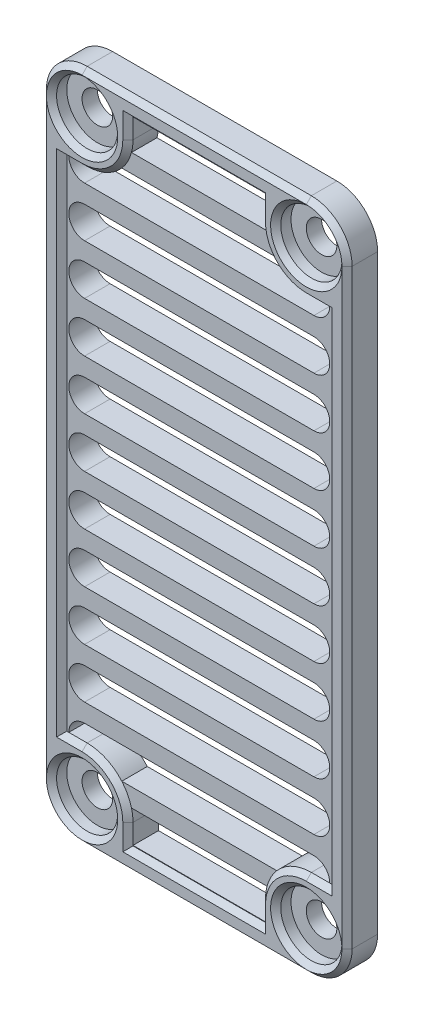
from build123d import *

# Parameters (mm, degrees)
BASE_DEPTH          = 3
SKETCH2_R           = 1.5
CUT_EXTRUDE1_DEPTH  = 37.373066959
CUT_EXTRUDE2_DEPTH  = 37.373066959
SKETCH6_R           = 3
CUT_EXTRUDE3_DEPTH  = 1.5
CHAMFER2_SIZE       = 0.5
BOSS_EXTRUDE1_START = -2.5
BOSS_EXTRUDE1_DEPTH = 2.5
CUT_EXTRUDE4_START  = -2.5
CUT_EXTRUDE4_DEPTH  = 2.5


# Read off the part's stored shape, not the designer's step: Cut-Extrude4
with BuildPart() as part:
    # Sketch1 → Base (new body)
    with BuildSketch(Plane.XY):
        with BuildLine():
            Line((11, -33), (-11, -33))
            ThreePointArc((-11, -33), (-13.828427125, -31.828427125), (-15, -29))
            Line((-15, -29), (-15, 29))
            ThreePointArc((-15, 29), (-13.828427125, 31.828427125), (-11, 33))
            Line((-11, 33), (11, 33))
            ThreePointArc((11, 33), (13.828427125, 31.828427125), (15, 29))
            Line((15, 29), (15, -29))
            ThreePointArc((15, -29), (13.828427125, -31.828427125), (11, -33))
        make_face()
    extrude(amount=BASE_DEPTH)

    # Sketch2 → Cut-Extrude1 (cut, through all)
    with BuildSketch(Plane.XY.offset(3)):
        with Locations((-11, 29)):
            Circle(SKETCH2_R)
        with Locations((-11, -29)):
            Circle(SKETCH2_R)
        with Locations((11, -29)):
            Circle(SKETCH2_R)
        with Locations((11, 29)):
            Circle(SKETCH2_R)
    extrude(amount=-CUT_EXTRUDE1_DEPTH, mode=Mode.SUBTRACT)

    # Sketch3 → Cut-Extrude2 (cut, through all)
    with BuildSketch(Plane.XY.offset(3)):
        with BuildLine():
            Line((6.5, 29), (6.5, 31))
            Line((6.5, 31), (-6.5, 31))
            Line((-6.5, 31), (-6.5, 29))
            ThreePointArc((-6.5, 29), (-7.818019485, 25.818019485), (-11, 24.5))
            Line((-11, 24.5), (-13, 24.5))
            Line((-13, 24.5), (-13, -24.5))
            Line((-13, -24.5), (-11, -24.5))
            ThreePointArc((-11, -24.5), (-7.818019485, -25.818019485), (-6.5, -29))
            Line((-6.5, -29), (-6.5, -31))
            Line((-6.5, -31), (6.5, -31))
            Line((6.5, -31), (6.5, -29))
            ThreePointArc((6.5, -29), (7.818019485, -25.818019485), (11, -24.5))
            Line((11, -24.5), (13, -24.5))
            Line((13, -24.5), (13, 24.5))
            Line((13, 24.5), (11, 24.5))
            ThreePointArc((11, 24.5), (7.818019485, 25.818019485), (6.5, 29))
        make_face()
    extrude(amount=-CUT_EXTRUDE2_DEPTH, mode=Mode.SUBTRACT)

    # Sketch6 → Cut-Extrude3 (cut)
    with BuildSketch(Plane.XY.offset(3)):
        with Locations((-11, -29)):
            Circle(SKETCH6_R)
        with Locations((11, -29)):
            Circle(SKETCH6_R)
        with Locations((11, 29)):
            Circle(SKETCH6_R)
        with Locations((-11, 29)):
            Circle(SKETCH6_R)
    extrude(amount=-CUT_EXTRUDE3_DEPTH, mode=Mode.SUBTRACT)

    # Chamfer2
    chamfer2_edges = [part.edges().sort_by_distance(p)[0] for p in [
        (7.818019485, 25.818019485, 3),
        (13, 0, 3),
        (7.818019485, -25.818019485, 3),
        (-7.818019485, -25.818019485, 3),
        (-13, 0, 3),
        (-7.818019485, 25.818019485, 3),
        (0, -33, 3),
        (-13.828427125, -31.828427125, 3),
        (-15, 0, 3),
        (-13.828427125, 31.828427125, 3),
        (0, 33, 3),
        (13.828427125, 31.828427125, 3),
        (15, 0, 3),
        (13.828427125, -31.828427125, 3),
        (-14, -29, 3),
        (-14, 29, 3),
        (8, 29, 3),
        (8, -29, 3),
        (0, -31, 3),
        (0, 31, 3),
        (12, 24.5, 3),
        (6.5, 30, 3),
        (-6.5, 30, 3),
        (-12, 24.5, 3),
        (-12, -24.5, 3),
        (-6.5, -30, 3),
        (6.5, -30, 3),
        (12, -24.5, 3),
    ]]
    chamfer(chamfer2_edges, length=CHAMFER2_SIZE - 0.0001)  # a hair under: the kernel refuses the full size

    # Sketch9 → Boss-Extrude1 (add)
    with BuildSketch(Plane(origin=(0, 0, 0), x_dir=(-1, 0, 0), z_dir=(0, 0, -1)).offset(BOSS_EXTRUDE1_START)):
        with BuildLine():
            ThreePointArc((-6.5, -29), (-7.818019485, -25.818019485), (-11, -24.5))
            Line((-11, -24.5), (-13, -24.5))
            Line((-13, -24.5), (-13, 24.5))
            Line((-13, 24.5), (-11, 24.5))
            ThreePointArc((-11, 24.5), (-7.818019485, 25.818019485), (-6.5, 29))
            Line((-6.5, 29), (-6.5, 31))
            Line((-6.5, 31), (6.5, 31))
            Line((6.5, 31), (6.5, 29))
            ThreePointArc((6.5, 29), (7.818019485, 25.818019485), (11, 24.5))
            Line((11, 24.5), (13, 24.5))
            Line((13, 24.5), (13, -24.5))
            Line((13, -24.5), (11, -24.5))
            ThreePointArc((11, -24.5), (7.818019485, -25.818019485), (6.5, -29))
            Line((6.5, -29), (6.5, -31))
            Line((6.5, -31), (-6.5, -31))
            Line((-6.5, -31), (-6.5, -29))
        make_face()
    extrude(amount=BOSS_EXTRUDE1_DEPTH)

    # Cut-Extrude4 outline → Cut-Extrude4 (cut)
    with BuildSketch(Plane(origin=(0, 0, 0), x_dir=(-1, 0, 0), z_dir=(0, 0, -1)).offset(CUT_EXTRUDE4_START)):
        with BuildLine():
            ThreePointArc((11.25, -6.45), (12.8, -4.9), (11.25, -3.35))
            Line((11.25, -3.35), (-11.25, -3.35))
            ThreePointArc((-11.25, -3.35), (-12.8, -4.9), (-11.25, -6.45))
            Line((-11.25, -6.45), (11.25, -6.45))
        make_face()
        with BuildLine():
            ThreePointArc((11.25, 18.05), (12.8, 19.6), (11.25, 21.15))
            Line((11.25, 21.15), (-11.25, 21.15))
            ThreePointArc((-11.25, 21.15), (-12.8, 19.6), (-11.25, 18.05))
            Line((-11.25, 18.05), (11.25, 18.05))
        make_face()
        with BuildLine():
            Line((-11, 24.5), (-12.8, 24.5))
            ThreePointArc((-12.8, 24.5), (-12.346015511, 23.403984489), (-11.25, 22.95))
            Line((-11.25, 22.95), (11.25, 22.95))
            ThreePointArc((11.25, 22.95), (12.346015511, 23.403984489), (12.8, 24.5))
            Line((12.8, 24.5), (11, 24.5))
            ThreePointArc((11, 24.5), (9.13251506, 24.905796781), (7.601838732, 26.05))
            Line((7.601838732, 26.05), (-7.601838732, 26.05))
            ThreePointArc((-7.601838732, 26.05), (-9.13251506, 24.905796781), (-11, 24.5))
        make_face()
        with BuildLine():
            ThreePointArc((-6.5, 29), (-6.537512687, 28.420166419), (-6.649425325, 27.85))
            Line((-6.649425325, 27.85), (6.649425325, 27.85))
            ThreePointArc((6.649425325, 27.85), (6.537512687, 28.420166419), (6.5, 29))
            Line((6.5, 29), (6.5, 30.95))
            Line((6.5, 30.95), (-6.5, 30.95))
            Line((-6.5, 30.95), (-6.5, 29))
        make_face()
        with BuildLine():
            Line((6.5, -30.95), (6.5, -29))
            ThreePointArc((6.5, -29), (6.537512687, -28.420166419), (6.649425325, -27.85))
            Line((6.649425325, -27.85), (-6.649425325, -27.85))
            ThreePointArc((-6.649425325, -27.85), (-6.537512687, -28.420166419), (-6.5, -29))
            Line((-6.5, -29), (-6.5, -30.95))
            Line((-6.5, -30.95), (6.5, -30.95))
        make_face()
        with BuildLine():
            Line((-11.25, -1.55), (11.25, -1.55))
            ThreePointArc((11.25, -1.55), (12.8, 0), (11.25, 1.55))
            Line((11.25, 1.55), (-11.25, 1.55))
            ThreePointArc((-11.25, 1.55), (-12.8, 0), (-11.25, -1.55))
        make_face()
        with BuildLine():
            ThreePointArc((11.25, -11.35), (12.8, -9.8), (11.25, -8.25))
            Line((11.25, -8.25), (-11.25, -8.25))
            ThreePointArc((-11.25, -8.25), (-12.8, -9.8), (-11.25, -11.35))
            Line((-11.25, -11.35), (11.25, -11.35))
        make_face()
        with BuildLine():
            ThreePointArc((11.25, -16.25), (12.8, -14.7), (11.25, -13.15))
            Line((11.25, -13.15), (-11.25, -13.15))
            ThreePointArc((-11.25, -13.15), (-12.8, -14.7), (-11.25, -16.25))
            Line((-11.25, -16.25), (11.25, -16.25))
        make_face()
        with BuildLine():
            ThreePointArc((11.25, -21.15), (12.8, -19.6), (11.25, -18.05))
            Line((11.25, -18.05), (-11.25, -18.05))
            ThreePointArc((-11.25, -18.05), (-12.8, -19.6), (-11.25, -21.15))
            Line((-11.25, -21.15), (11.25, -21.15))
        make_face()
        with BuildLine():
            ThreePointArc((12.8, -24.5), (12.346015511, -23.403984489), (11.25, -22.95))
            Line((11.25, -22.95), (-11.25, -22.95))
            ThreePointArc((-11.25, -22.95), (-12.346015511, -23.403984489), (-12.8, -24.5))
            Line((-12.8, -24.5), (-11, -24.5))
            ThreePointArc((-11, -24.5), (-9.13251506, -24.905796781), (-7.601838732, -26.05))
            Line((-7.601838732, -26.05), (7.601838732, -26.05))
            ThreePointArc((7.601838732, -26.05), (9.13251506, -24.905796781), (11, -24.5))
            Line((11, -24.5), (12.8, -24.5))
        make_face()
        with BuildLine():
            ThreePointArc((11.25, 3.35), (12.8, 4.9), (11.25, 6.45))
            Line((11.25, 6.45), (-11.25, 6.45))
            ThreePointArc((-11.25, 6.45), (-12.8, 4.9), (-11.25, 3.35))
            Line((-11.25, 3.35), (11.25, 3.35))
        make_face()
        with BuildLine():
            ThreePointArc((11.25, 8.25), (12.8, 9.8), (11.25, 11.35))
            Line((11.25, 11.35), (-11.25, 11.35))
            ThreePointArc((-11.25, 11.35), (-12.8, 9.8), (-11.25, 8.25))
            Line((-11.25, 8.25), (11.25, 8.25))
        make_face()
        with BuildLine():
            ThreePointArc((11.25, 13.15), (12.8, 14.7), (11.25, 16.25))
            Line((11.25, 16.25), (-11.25, 16.25))
            ThreePointArc((-11.25, 16.25), (-12.8, 14.7), (-11.25, 13.15))
            Line((-11.25, 13.15), (11.25, 13.15))
        make_face()
    extrude(amount=CUT_EXTRUDE4_DEPTH, mode=Mode.SUBTRACT)


solid = part.part
